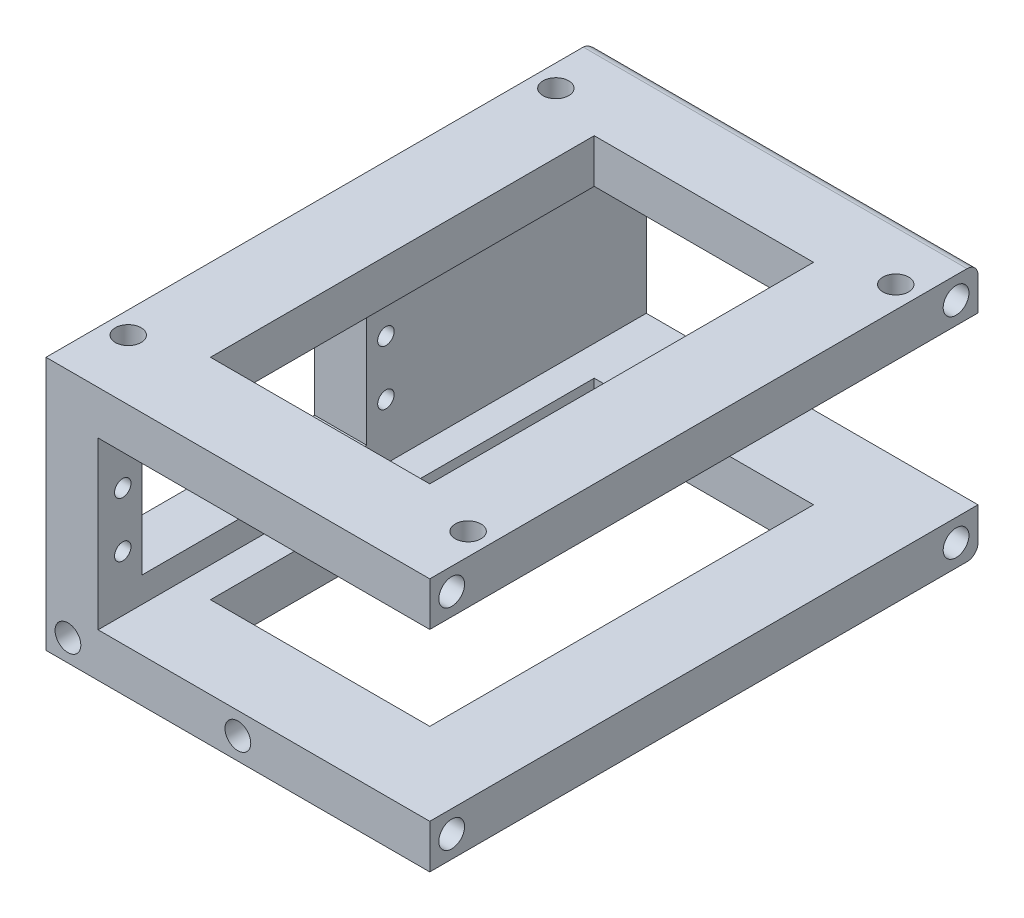
from build123d import *

# Parameters (mm, degrees)
BOSS_EXTRUDE1_DEPTH = 100
SKETCH2_W           = 40
SKETCH2_H           = 70
CUT_EXTRUDE1_DEPTH  = 100
SKETCH3_R           = 2.35
CUT_EXTRUDE2_DEPTH  = 6
CUT_EXTRUDE3_REACH  = 127.714
SKETCH4_R           = 1.5
SKETCH4_W           = 41
SKETCH4_H           = 21
SKETCH5_R           = 2.35
CUT_EXTRUDE4_DEPTH  = 6
SKETCH6_R           = 2.35
CUT_EXTRUDE5_DEPTH  = 6
CUT_EXTRUDE6_START  = -6
SKETCH7_R           = 2.35
CUT_EXTRUDE6_DEPTH  = 6
FILLET2_R           = 2


with BuildPart() as part:
    # Sketch1 → Boss-Extrude1 (new body)
    with BuildSketch(Plane.XY):
        Polygon((0, 46.3), (0, 0), (70, 0), (70, 8), (9.5, 8), (9.5, 38.3), (70, 38.3), (70, 46.3), align=None)
    extrude(amount=BOSS_EXTRUDE1_DEPTH)

    # Sketch2 → Cut-Extrude1 (cut)
    with BuildSketch(Plane.XZ):
        with Locations((35, 50)):
            Rectangle(SKETCH2_W, SKETCH2_H)
    extrude(amount=-CUT_EXTRUDE1_DEPTH, mode=Mode.SUBTRACT)

    # Sketch3 → Cut-Extrude2 (cut)
    with BuildSketch(Plane(origin=(70, 0, 0), x_dir=(0, 0, -1), z_dir=(1, 0, 0))):
        with Locations((-96, 42.3)):
            Circle(SKETCH3_R)
        with Locations(Location((-4, 42.3, 0), (0, 0, 180))):
            Circle(SKETCH3_R)
        with Locations((-4, 4)):
            Circle(SKETCH3_R)
        with Locations(Location((-96, 4, 0), (0, 0, 180))):
            Circle(SKETCH3_R)
    extrude(amount=-CUT_EXTRUDE2_DEPTH, mode=Mode.SUBTRACT)

    # Sketch4 → Cut-Extrude3 (cut, up to next)
    with BuildSketch(Plane(origin=(9.5, 0, 0), x_dir=(0, 0, -1), z_dir=(1, 0, 0)), mode=Mode.PRIVATE) as cut_extrude3_sk1:
        with Locations((-95.5, 28.15)):
            Circle(SKETCH4_R)
    cut_extrude3_tool1 = extrude(cut_extrude3_sk1.sketch, amount=-CUT_EXTRUDE3_REACH, mode=Mode.PRIVATE) & part.part
    # Sketch4 → Cut-Extrude3 (cut, up to next)
    with BuildSketch(Plane(origin=(9.5, 0, 0), x_dir=(0, 0, -1), z_dir=(1, 0, 0)), mode=Mode.PRIVATE) as cut_extrude3_sk2:
        with Locations((-95.5, 18.15)):
            Circle(SKETCH4_R)
    cut_extrude3_tool2 = extrude(cut_extrude3_sk2.sketch, amount=-CUT_EXTRUDE3_REACH, mode=Mode.PRIVATE) & part.part
    # Sketch4 → Cut-Extrude3 (cut, up to next)
    with BuildSketch(Plane(origin=(9.5, 0, 0), x_dir=(0, 0, -1), z_dir=(1, 0, 0)), mode=Mode.PRIVATE) as cut_extrude3_sk3:
        with Locations((-47.5, 18.15)):
            Circle(SKETCH4_R)
    cut_extrude3_tool3 = extrude(cut_extrude3_sk3.sketch, amount=-CUT_EXTRUDE3_REACH, mode=Mode.PRIVATE) & part.part
    # Sketch4 → Cut-Extrude3 (cut, up to next)
    with BuildSketch(Plane(origin=(9.5, 0, 0), x_dir=(0, 0, -1), z_dir=(1, 0, 0)), mode=Mode.PRIVATE) as cut_extrude3_sk4:
        with Locations((-47.5, 28.15)):
            Circle(SKETCH4_R)
    cut_extrude3_tool4 = extrude(cut_extrude3_sk4.sketch, amount=-CUT_EXTRUDE3_REACH, mode=Mode.PRIVATE) & part.part
    # Sketch4 → Cut-Extrude3 (cut, up to next)
    with BuildSketch(Plane(origin=(9.5, 0, 0), x_dir=(0, 0, -1), z_dir=(1, 0, 0)), mode=Mode.PRIVATE) as cut_extrude3_sk5:
        with Locations((-71.5, 23.15)):
            Rectangle(SKETCH4_W, SKETCH4_H)
    cut_extrude3_tool5 = extrude(cut_extrude3_sk5.sketch, amount=-CUT_EXTRUDE3_REACH, mode=Mode.PRIVATE) & part.part
    add(cut_extrude3_tool1.solids().sort_by_distance((9.5, 28.15, 95.5))[0], mode=Mode.SUBTRACT)
    add(cut_extrude3_tool2.solids().sort_by_distance((9.5, 18.15, 95.5))[0], mode=Mode.SUBTRACT)
    add(cut_extrude3_tool3.solids().sort_by_distance((9.5, 18.15, 47.5))[0], mode=Mode.SUBTRACT)
    add(cut_extrude3_tool4.solids().sort_by_distance((9.5, 28.15, 47.5))[0], mode=Mode.SUBTRACT)
    add(cut_extrude3_tool5.solids().sort_by_distance((9.5, 23.15, 71.5))[0], mode=Mode.SUBTRACT)

    # Sketch5 → Cut-Extrude4 (cut)
    with BuildSketch(Plane(origin=(0, 46.3, 0), x_dir=(1, 0, 0), z_dir=(0, 1, 0))):
        with Locations((4, -89)):
            Circle(SKETCH5_R)
        with Locations(Location((66, -89, 0), (0, 0, 180))):
            Circle(SKETCH5_R)
        with Locations((66, -11)):
            Circle(SKETCH5_R)
        with Locations(Location((4, -11, 0), (0, 0, 180))):
            Circle(SKETCH5_R)
    extrude(amount=-CUT_EXTRUDE4_DEPTH, mode=Mode.SUBTRACT)

    # Sketch6 → Cut-Extrude5 (cut)
    with BuildSketch(Plane.XY.offset(100)):
        with Locations((4, 4)):
            Circle(SKETCH6_R)
        with Locations((35, 4)):
            Circle(SKETCH6_R)
    extrude(amount=-CUT_EXTRUDE5_DEPTH, mode=Mode.SUBTRACT)

    # Sketch7 → Cut-Extrude6 (cut)
    with BuildSketch(Plane(origin=(0, 0, 0), x_dir=(-1, 0, 0), z_dir=(0, 0, -1)).offset(CUT_EXTRUDE6_START)):
        with Locations(Location((-35, 4, 0), (0, 0, 180))):
            Circle(SKETCH7_R)
        with Locations(Location((-4, 4, 0), (0, 0, 180))):
            Circle(SKETCH7_R)
    extrude(amount=CUT_EXTRUDE6_DEPTH, mode=Mode.SUBTRACT)

    # Fillet2
    # the kernel refuses this fillet: 2 mm, written as the material it takes off along each edge
    with BuildSketch(Plane(origin=(-5, 0, 0), x_dir=(0, 1, 0), z_dir=(1, 0, 0))) as fillet2_piece_1:
        with BuildLine():
            CenterArc((FILLET2_R, FILLET2_R), FILLET2_R, 180, 90)
            Line((0, FILLET2_R), (0, 0))
            Line((0, 0), (FILLET2_R, 0))
        make_face()
    extrude(amount=80, mode=Mode.SUBTRACT)
    with BuildSketch(Plane(origin=(0, 51.3, 0), x_dir=(0, 0, 1), z_dir=(0, -1, 0))) as fillet2_piece_2:
        with BuildLine():
            CenterArc((FILLET2_R, -FILLET2_R), FILLET2_R, 90, 90)
            Line((0, -FILLET2_R), (0, 0))
            Line((0, 0), (FILLET2_R, 0))
        make_face()
    extrude(amount=56.3, mode=Mode.SUBTRACT)
    with BuildSketch(Plane(origin=(75, 46.3, 0), x_dir=(0, 0, 1), z_dir=(-1, 0, 0))) as fillet2_piece_3:
        with BuildLine():
            CenterArc((FILLET2_R, -FILLET2_R), FILLET2_R, 90, 90)
            Line((0, -FILLET2_R), (0, 0))
            Line((0, 0), (FILLET2_R, 0))
        make_face()
    extrude(amount=80, mode=Mode.SUBTRACT)


solid = part.part
